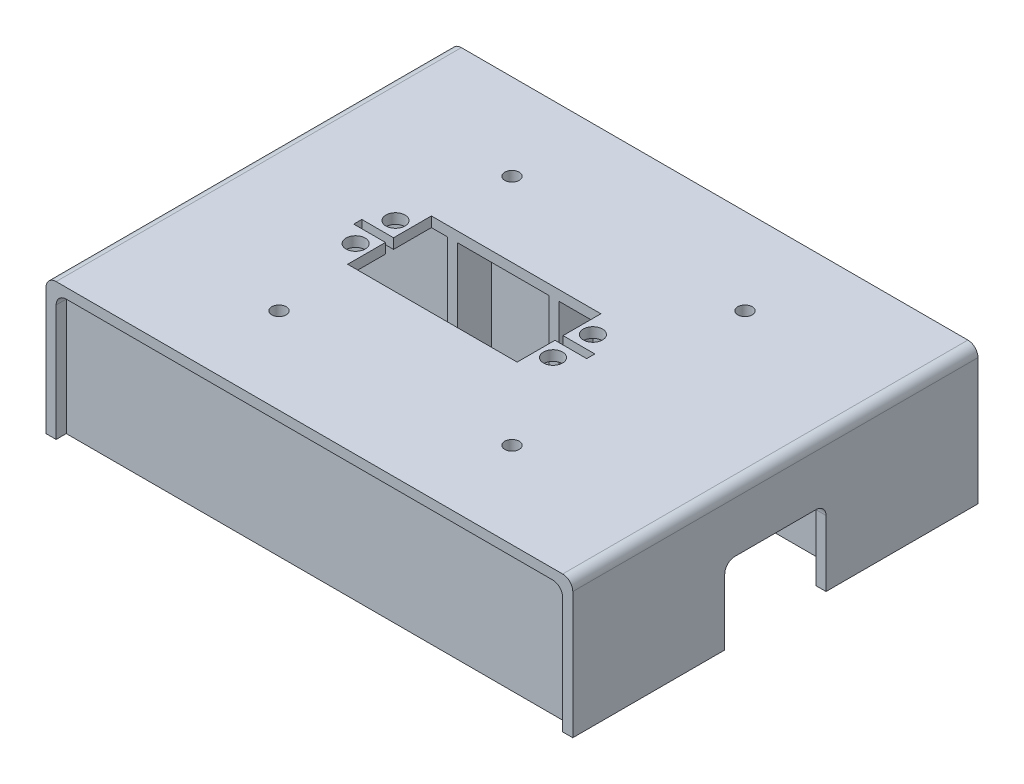
from build123d import *

# Parameters (mm, degrees)
EXTRUDE_THIN1_DEPTH  = 50.8
CUT_EXTRUDE1_REACH   = 92.098
SKETCH4_W            = 25.4
SKETCH4_H            = 19.05
FILLET1_R            = 2.54
EXTRUDE_THIN2_REACH  = 92.098
SKETCH3_W            = 63.5
SKETCH3_H            = 2.54
SKETCH9_W            = 2.54
SKETCH9_H            = 38.1
SKETCH9_H_2          = 91.44
SKETCH9_H_3          = 24.13
EXTRUDE_THIN3_DEPTH  = 31.75
CUT_EXTRUDE2_REACH   = 92.098
SKETCH5_W            = 42.5
SKETCH5_H            = 21
M4_CLEARANCE_HOLE1_D = 4.8
CUT_EXTRUDE4_REACH   = 92.098
SKETCH7_W            = 7.96
SKETCH7_H            = 2.032
CUT_EXTRUDE5_REACH   = 113.138
SKETCH10_W           = 12.7
SKETCH10_H           = 9.525
M3_CLEARANCE_HOLE1_D = 3.6


# Read off the part's stored shape, not the designer's step: Mirror2
with BuildPart() as part:
    # Sketch2 → Extrude-Thin1 (new, symmetric)
    with BuildSketch(Plane.XY):
        Polygon((0, 31.75), (63.5, 31.75), (63.5, 0), (66.04, 0), (66.04, 34.29), (0, 34.29), align=None)
    extrude(amount=EXTRUDE_THIN1_DEPTH, both=True)

    # Sketch4 → Cut-Extrude1 (cut, up to next)
    with BuildSketch(Plane(origin=(66.04, 0, 0), x_dir=(0, 0, -1), z_dir=(1, 0, 0)), mode=Mode.PRIVATE) as cut_extrude1_sk1:
        with Locations((0, 9.525)):
            Rectangle(SKETCH4_W, SKETCH4_H)
    cut_extrude1_tool1 = extrude(cut_extrude1_sk1.sketch, amount=-CUT_EXTRUDE1_REACH, mode=Mode.PRIVATE) & part.part
    add(cut_extrude1_tool1.solids().sort_by_distance((66.04, 9.525, 0))[0], mode=Mode.SUBTRACT)

    # Fillet1
    fillet1_edges = [part.edges().sort_by_distance(p)[0] for p in [
        (64.77, 19.05, 12.7),
        (64.77, 19.05, -12.7),
        (63.5, 31.75, 0),
        (66.04, 34.29, 0),
    ]]
    fillet(fillet1_edges, radius=FILLET1_R)

    # Sketch3 → Extrude-Thin2 (add, up to next)
    with BuildSketch(Plane.XZ, mode=Mode.PRIVATE) as extrude_thin2_sk1:
        with Locations((31.75, 20.32)):
            Rectangle(SKETCH3_W, SKETCH3_H)
    extrude_thin2_tool1 = extrude(extrude_thin2_sk1.sketch, amount=-EXTRUDE_THIN2_REACH, mode=Mode.PRIVATE) - part.part
    # Sketch3 → Extrude-Thin2 (add, up to next)
    with BuildSketch(Plane.XZ, mode=Mode.PRIVATE) as extrude_thin2_sk2:
        with Locations((31.75, 46.99)):
            Rectangle(SKETCH3_W, SKETCH3_H)
    extrude_thin2_tool2 = extrude(extrude_thin2_sk2.sketch, amount=-EXTRUDE_THIN2_REACH, mode=Mode.PRIVATE) - part.part
    extrude_thin2_1 = extrude_thin2_tool1.solids().sort_by_distance((31.75, 0, 20.32))[0]
    add(extrude_thin2_1)
    extrude_thin2_2 = extrude_thin2_tool2.solids().sort_by_distance((31.75, 0, 46.99))[0]
    add(extrude_thin2_2)
    extrude_thin2 = extrude_thin2_1 + extrude_thin2_2  # Extrude-Thin2 as one shape, for the pattern or mirror that repeats it

    # Mirror1: Extrude-Thin2 across plane
    add(extrude_thin2.mirror(Plane.XY))

    # Mirror2: part across plane


with BuildPart() as part_1:
    add(part.part)
    add(part.part.mirror(Plane(origin=(0, 0, 0), x_dir=(0, 0, 1), z_dir=(1, 0, 0))))

    # Sketch9 → Extrude-Thin3 (add)
    with BuildSketch(Plane.XZ):
        with Locations((-25.4, 0)):
            Rectangle(SKETCH9_W, SKETCH9_H)
        Rectangle(SKETCH9_W, SKETCH9_H_2)
        with Locations((25.4, 0)):
            Rectangle(SKETCH9_W, SKETCH9_H)
        with Locations((-35.56, 33.655)):
            Rectangle(SKETCH9_W, SKETCH9_H_3)
        with Locations((-35.56, -33.655)):
            Rectangle(SKETCH9_W, SKETCH9_H_3)
        with Locations((35.56, 33.655)):
            Rectangle(SKETCH9_W, SKETCH9_H_3)
        with Locations((35.56, -33.655)):
            Rectangle(SKETCH9_W, SKETCH9_H_3)
    extrude(amount=-EXTRUDE_THIN3_DEPTH)

    # Sketch5 → Cut-Extrude2 (cut, up to next)
    with BuildSketch(Plane(origin=(0, 34.29, 0), x_dir=(1, 0, 0), z_dir=(0, 1, 0)), mode=Mode.PRIVATE) as cut_extrude2_sk1:
        with Locations((-9.464, 0)):
            Rectangle(SKETCH5_W, SKETCH5_H)
    cut_extrude2_tool1 = extrude(cut_extrude2_sk1.sketch, amount=-CUT_EXTRUDE2_REACH, mode=Mode.PRIVATE) & part_1.part
    add(cut_extrude2_tool1.solids().sort_by_distance((-9.464, 34.29, 0))[0], mode=Mode.SUBTRACT)

    # M4 Clearance Hole1 (through all)
    with Locations(Plane(origin=(0, 34.29, 0), x_dir=(1, 0, 0), z_dir=(0, 1, 0))):
        with Locations((15.286, -5), (15.286, 5), (-34.214, 5), (-34.214, -5)):
            Hole(M4_CLEARANCE_HOLE1_D / 2)

    # Sketch7 → Cut-Extrude4 (cut, up to next)
    with BuildSketch(Plane(origin=(0, 34.29, 0), x_dir=(1, 0, 0), z_dir=(0, 1, 0)), mode=Mode.PRIVATE) as cut_extrude4_sk1:
        with Locations((15.766, 0)):
            Rectangle(SKETCH7_W, SKETCH7_H)
    cut_extrude4_tool1 = extrude(cut_extrude4_sk1.sketch, amount=-CUT_EXTRUDE4_REACH, mode=Mode.PRIVATE) & part_1.part
    # Sketch7 → Cut-Extrude4 (cut, up to next)
    with BuildSketch(Plane(origin=(0, 34.29, 0), x_dir=(1, 0, 0), z_dir=(0, 1, 0)), mode=Mode.PRIVATE) as cut_extrude4_sk2:
        with Locations((-34.694, 0)):
            Rectangle(SKETCH7_W, SKETCH7_H)
    cut_extrude4_tool2 = extrude(cut_extrude4_sk2.sketch, amount=-CUT_EXTRUDE4_REACH, mode=Mode.PRIVATE) & part_1.part
    add(cut_extrude4_tool1.solids().sort_by_distance((15.766, 34.29, 0))[0], mode=Mode.SUBTRACT)
    add(cut_extrude4_tool2.solids().sort_by_distance((-34.694, 34.29, 0))[0], mode=Mode.SUBTRACT)

    # Sketch10 → Cut-Extrude5 (cut, up to next)
    with BuildSketch(Plane(origin=(26.67, 0, 0), x_dir=(0, 0, -1), z_dir=(1, 0, 0)), mode=Mode.PRIVATE) as cut_extrude5_sk1:
        with Locations((0, 4.7625)):
            Rectangle(SKETCH10_W, SKETCH10_H)
    cut_extrude5_tool1 = extrude(cut_extrude5_sk1.sketch, amount=-CUT_EXTRUDE5_REACH, mode=Mode.PRIVATE) & part_1.part
    add(cut_extrude5_tool1.solids().sort_by_distance((26.67, 4.7625, 0))[0], mode=Mode.SUBTRACT)

    # M3 Clearance Hole1 (through all)
    with Locations(Plane(origin=(0, 34.29, 0), x_dir=(1, 0, 0), z_dir=(0, 1, 0))):
        with Locations((-29.21, 29.21), (29.21, 29.21), (29.21, -29.21), (-29.21, -29.21)):
            Hole(M3_CLEARANCE_HOLE1_D / 2)


solid = part_1.part
